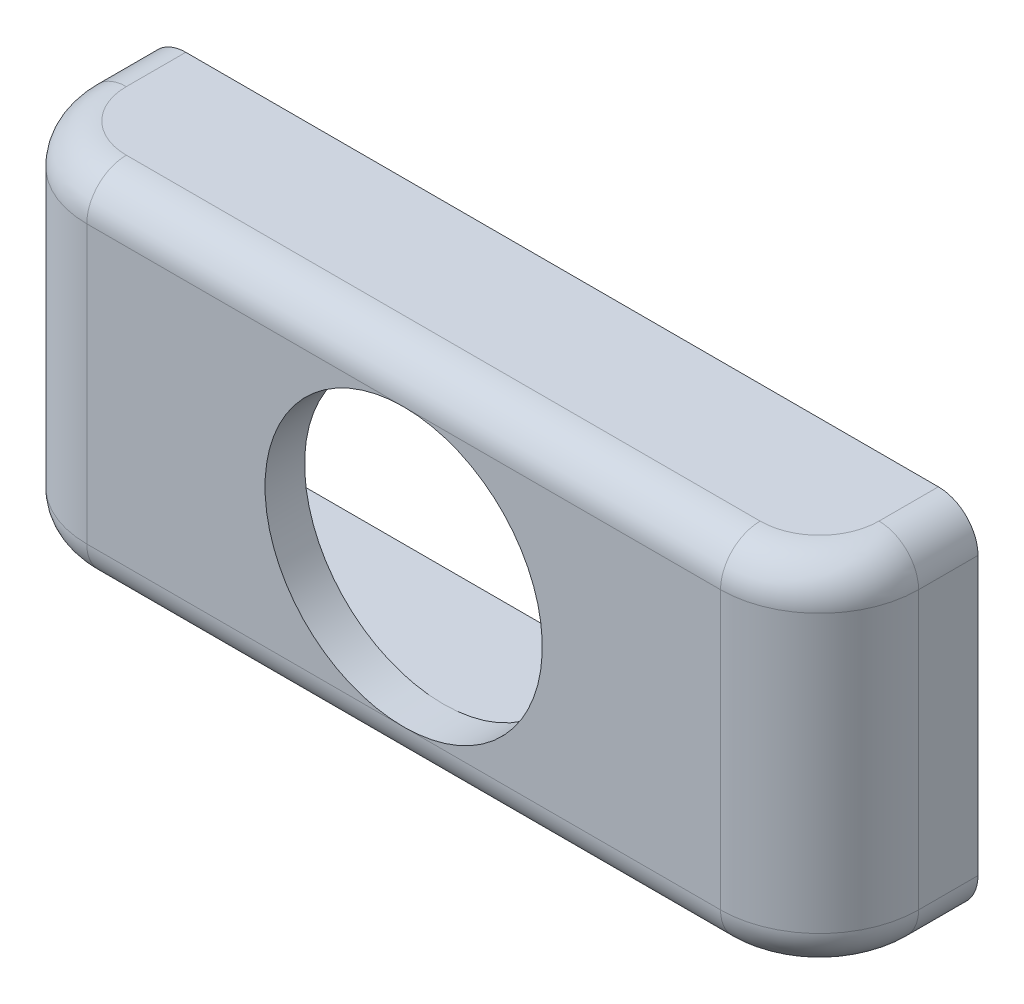
from build123d import *

# Parameters (mm, degrees)
SKETCH1_W           = 42
SKETCH1_H           = 18
BOSS_EXTRUDE1_DEPTH = 8
FILLET1_R           = 5
FILLET2_R           = 2
SHELL1_START        = -7
SHELL1_DEPTH        = 14
SKETCH2_R           = 7
CUT_EXTRUDE1_DEPTH  = 25.207436874


# Read off the part's stored shape, not the designer's step: Shell1
with BuildPart() as part:
    # Sketch1 → Boss-Extrude1 (new body)
    with BuildSketch(Plane.XY):
        Rectangle(SKETCH1_W, SKETCH1_H)
    extrude(amount=BOSS_EXTRUDE1_DEPTH)

    # Fillet1
    fillet1_edges = [part.edges().sort_by_distance(p)[0] for p in [
        (21, 0, 8),
        (-21, 0, 8),
    ]]
    fillet(fillet1_edges, radius=FILLET1_R)

    # Fillet2
    fillet2_edges = [part.edges().sort_by_distance(p)[0] for p in [
        (0, -9, 8),
        (0, 9, 8),
        (21, -9, 1.5),
        (-21, -9, 1.5),
        (19.535533906, -9, 6.535533906),
        (-19.535533906, -9, 6.535533906),
        (-21, 9, 1.5),
        (21, 9, 1.5),
        (19.535533906, 9, 6.535533906),
        (-19.535533906, 9, 6.535533906),
    ]]
    fillet(fillet2_edges, radius=FILLET2_R)

    # Shell1 outline → Shell1 (cut)
    with BuildSketch(Plane(origin=(0, 0, 0), x_dir=(1, 0, 0), z_dir=(0, 1, 0)).offset(SHELL1_START)):
        with BuildLine():
            Line((-19, 0), (-19, -3))
            ThreePointArc((-19, -3), (-18.121320344, -5.121320344), (-16, -6))
            Line((-16, -6), (16, -6))
            ThreePointArc((16, -6), (18.121320344, -5.121320344), (19, -3))
            Line((19, -3), (19, 0))
            Line((19, 0), (-19, 0))
        make_face()
    extrude(amount=SHELL1_DEPTH, mode=Mode.SUBTRACT)

    # Sketch2 → Cut-Extrude1 (cut, through all)
    with BuildSketch(Plane.XY.offset(8)):
        with Locations(Location((0, 0, 0), (0, 0, 270))):
            Circle(SKETCH2_R)
    extrude(amount=-CUT_EXTRUDE1_DEPTH, mode=Mode.SUBTRACT)


solid = part.part
